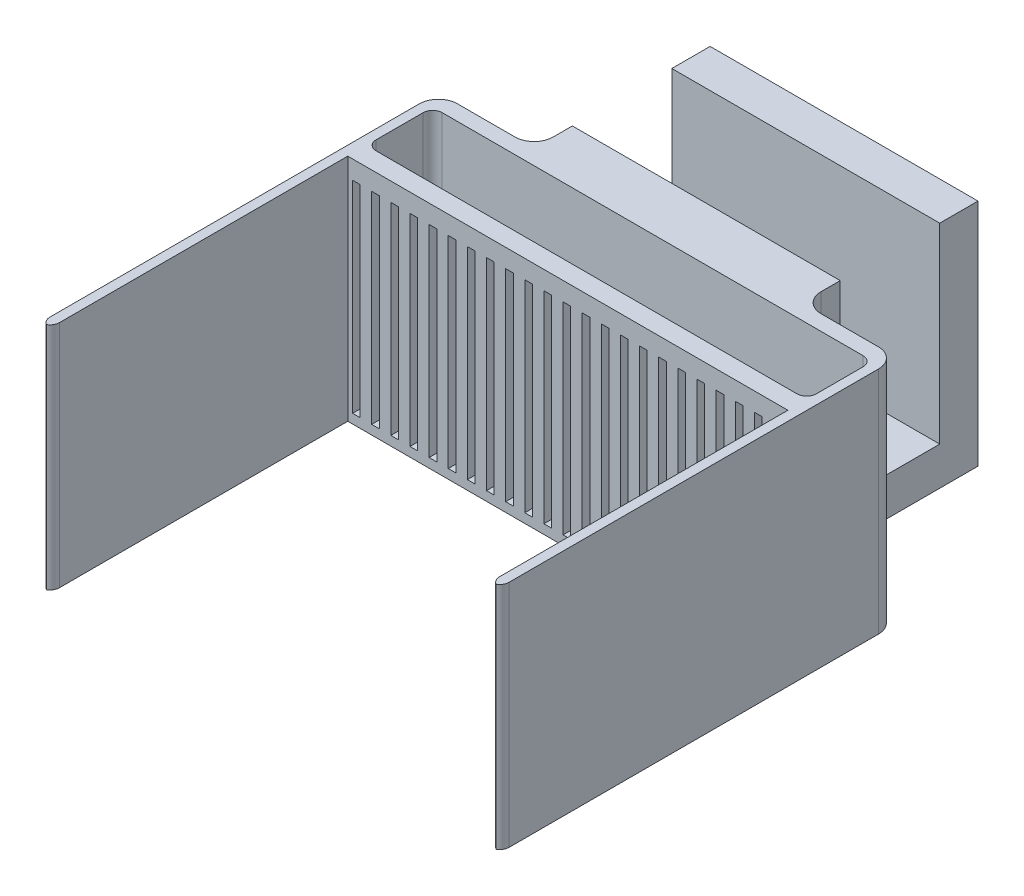
from build123d import *

# Parameters (mm, degrees)
ESQUISSE3_W             = 14
ESQUISSE3_H             = 2
BOSS_EXTRU_1_DEPTH      = 10
BOSS_EXTRU_1_2_DEPTH    = 10
ESQUISSE4_W             = 9.2
ESQUISSE4_H             = 2
BOSS_EXTRU_2_DEPTH      = 14
BOSS_EXTRU_3_DEPTH      = 12
CONG_2_R                = 0.5
CONG_4_R                = 1
CONG_5_R                = 1
CONG_6_R                = 1
ESQUISSE6_W             = 23
ESQUISSE6_H             = 0.979911891
BOSS_EXTRU_4_DEPTH      = 12
CONG_8_R                = 0.5
ESQUISSE7_W             = 0.4
ESQUISSE7_H             = 10.548698827
ENL_V_MAT_EXTRU_1_DEPTH = 1.5


with BuildPart() as part:
    # Esquisse3 → Boss.-Extru.1 (new body)
    with BuildSketch(Plane(origin=(0, 0, 0), x_dir=(1, 0, 0), z_dir=(0, 1, 0))):
        with Locations((-7, 6.2)):
            Rectangle(ESQUISSE3_W, ESQUISSE3_H)
    extrude(amount=BOSS_EXTRU_1_DEPTH)



with BuildPart() as body_2:
    # Esquisse3 → Boss.-Extru.1 2 (new body)
    with BuildSketch(Plane(origin=(0, 0, 0), x_dir=(1, 0, 0), z_dir=(0, 1, 0))):
        with Locations((-7, -1)):
            Rectangle(ESQUISSE3_W, ESQUISSE3_H)
    extrude(amount=BOSS_EXTRU_1_2_DEPTH)


with BuildPart() as part_1:
    add(part.part)

    add(body_2.part)  # Boss.-Extru.2 merges body 2
    # Esquisse4 → Boss.-Extru.2 (add)
    with BuildSketch(Plane(origin=(0, 0, 0), x_dir=(0, 0, -1), z_dir=(1, 0, 0))):
        with Locations((2.6, -1)):
            Rectangle(ESQUISSE4_W, ESQUISSE4_H)
    extrude(amount=-BOSS_EXTRU_2_DEPTH)

    # Esquisse5 → Boss.-Extru.3 (add)
    with BuildSketch(Plane.XZ.offset(2)):
        Polygon((-14, 2), (-19, 2), (-19, 22.8), (-18.5, 22.8), (-18.5, 2.8), (4.5, 2.8), (4.5, 22.8), (5, 22.8), (5, 2), (0, 2), align=None)
    extrude(amount=-BOSS_EXTRU_3_DEPTH)

    # Congé2
    # the kernel refuses this fillet: 0.5 mm, written as the material it takes off along each edge
    with BuildSketch(Plane(origin=(-19, -3.25, 22.8), x_dir=(0, 0, -1), z_dir=(0, 1, 0)), Plane(origin=(-18.5, -3.25, 22.8), x_dir=(-1, 0, 0), z_dir=(0, 1, 0)), Plane(origin=(4.5, -3.25, 22.8), x_dir=(0, 0, -1), z_dir=(0, 1, 0)), Plane(origin=(5, -3.25, 22.8), x_dir=(-1, 0, 0), z_dir=(0, 1, 0))) as cong_2_piece_1:
        with BuildLine():
            CenterArc((CONG_2_R, -CONG_2_R), CONG_2_R, 90, 90)
            Line((0, -CONG_2_R), (0, 0))
            Line((0, 0), (CONG_2_R, 0))
        make_face()
    extrude(amount=14.5, mode=Mode.SUBTRACT)

    # Congé4
    cong_4_edges = [part_1.edges().sort_by_distance(p)[0] for p in [
        (-19, 4, 2),
    ]]
    fillet(cong_4_edges, radius=CONG_4_R)

    # Congé5
    cong_5_edges = [part_1.edges().sort_by_distance(p)[0] for p in [
        (5, 4, 2),
    ]]
    fillet(cong_5_edges, radius=CONG_5_R)

    # Congé6
    cong_6_edges = [part_1.edges().sort_by_distance(p)[0] for p in [
        (-14, 4, 2),
        (0, 4, 2),
    ]]
    fillet(cong_6_edges, radius=CONG_6_R)

    # Esquisse6 → Boss.-Extru.4 (add)
    with BuildSketch(Plane(origin=(0, -2, 0), x_dir=(-1, 0, 0), z_dir=(0, -1, 0))):
        with Locations((7, -6.745764799)):
            Rectangle(ESQUISSE6_W, ESQUISSE6_H)
    extrude(amount=-BOSS_EXTRU_4_DEPTH)

    # Congé8
    cong_8_edges = [part_1.edges().sort_by_distance(p)[0] for p in [
        (-18.5, 4, 6.255808853),
        (4.5, 4, 6.255808853),
        (-18.5, 4, 2.8),
        (4.5, 4, 2.8),
    ]]
    fillet(cong_8_edges, radius=CONG_8_R)

    # Esquisse7 → Enlèv. mat.-Extru.1 (cut)
    with BuildSketch(Plane.XY.offset(7.235720744)):
        with Locations((-18.05, 3.759681921)):
            Rectangle(ESQUISSE7_W, ESQUISSE7_H)
        with Locations((-17.05, 3.759681921)):
            Rectangle(ESQUISSE7_W, ESQUISSE7_H)
        with Locations((-16.05, 3.759681921)):
            Rectangle(ESQUISSE7_W, ESQUISSE7_H)
        with Locations((-15.05, 3.759681921)):
            Rectangle(ESQUISSE7_W, ESQUISSE7_H)
        with Locations((-14.05, 3.759681921)):
            Rectangle(ESQUISSE7_W, ESQUISSE7_H)
        with Locations((-13.05, 3.759681921)):
            Rectangle(ESQUISSE7_W, ESQUISSE7_H)
        with Locations((-12.05, 3.759681921)):
            Rectangle(ESQUISSE7_W, ESQUISSE7_H)
        with Locations((-11.05, 3.759681921)):
            Rectangle(ESQUISSE7_W, ESQUISSE7_H)
        with Locations((-10.05, 3.759681921)):
            Rectangle(ESQUISSE7_W, ESQUISSE7_H)
        with Locations((-9.05, 3.759681921)):
            Rectangle(ESQUISSE7_W, ESQUISSE7_H)
        with Locations((-8.05, 3.759681921)):
            Rectangle(ESQUISSE7_W, ESQUISSE7_H)
        with Locations((-7.05, 3.759681921)):
            Rectangle(ESQUISSE7_W, ESQUISSE7_H)
        with Locations((-6.05, 3.759681921)):
            Rectangle(ESQUISSE7_W, ESQUISSE7_H)
        with Locations((-5.05, 3.759681921)):
            Rectangle(ESQUISSE7_W, ESQUISSE7_H)
        with Locations((-4.05, 3.759681921)):
            Rectangle(ESQUISSE7_W, ESQUISSE7_H)
        with Locations((-3.05, 3.759681921)):
            Rectangle(ESQUISSE7_W, ESQUISSE7_H)
        with Locations((-2.05, 3.759681921)):
            Rectangle(ESQUISSE7_W, ESQUISSE7_H)
        with Locations((-1.05, 3.759681921)):
            Rectangle(ESQUISSE7_W, ESQUISSE7_H)
        with Locations((-0.05, 3.759681921)):
            Rectangle(ESQUISSE7_W, ESQUISSE7_H)
        with Locations((0.95, 3.759681921)):
            Rectangle(ESQUISSE7_W, ESQUISSE7_H)
        with Locations((1.95, 3.759681921)):
            Rectangle(ESQUISSE7_W, ESQUISSE7_H)
        with Locations((2.95, 3.759681921)):
            Rectangle(ESQUISSE7_W, ESQUISSE7_H)
        with Locations((3.95, 3.759681921)):
            Rectangle(ESQUISSE7_W, ESQUISSE7_H)
    extrude(amount=-ENL_V_MAT_EXTRU_1_DEPTH, mode=Mode.SUBTRACT)


solid = part_1.part
